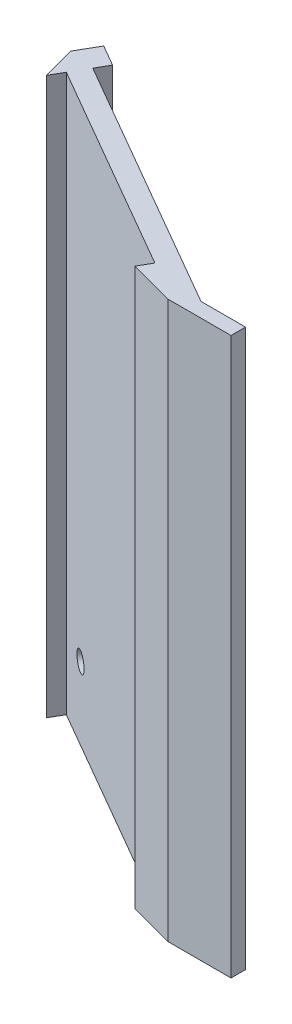
from build123d import *

# Parameters (mm, degrees)
BOSS_EXTRU_1_DEPTH      = 115
ESQUISSE3_R             = 2.0000000000000027
ESQUISSE3_R_2           = 2.0000000000000036
ENL_V_MAT_EXTRU_1_DEPTH = 115
ESQUISSE4_W             = 16
ESQUISSE4_H             = 22
BOSS_EXTRU_2_DEPTH      = 3
CONG_1_R                = 3.5


with BuildPart() as part:
    # Esquisse1 → Boss.-Extru.1 (new body)
    with BuildSketch(Plane(origin=(0, 0, 0), x_dir=(1, 0, 0), z_dir=(0, 1, 0))):
        Polygon((-9.665063509740824, 2.102761677791812), (-11.16506350974071, -0.4953145335614556), (-1.834936490818464, -2.99531453356143), (11.165063509180728, -2.9953145335603057), (11.165063509180731, 0.00468546643886736), (1.9689110864743, 0.00468546643886637), (-7.660052187463922, 5.563970004664114), (-50.96633369896256, 30.56686329292954), (-49.46633369896244, 33.164939504283076), (-53.79646071788463, 35.664939504283076), (-55.29646071788474, 33.06686329292953), (-56.29646071788462, 31.334812485360874), (-54.466333698962515, 24.504685466438406), (-52.96633369896275, 27.10276167779183), align=None)
    extrude(amount=BOSS_EXTRU_1_DEPTH)

    # Esquisse3 → Enlèv. mat.-Extru.1 (cut)
    with BuildSketch(Plane(origin=(-1.5057433618991607, 0, 2.6080240059689155), x_dir=(0.8660254037844384, 0, 0.5000000000000006), z_dir=(-0.5000000000000006, 0, 0.8660254037844385))):
        with Locations((-51.421571367521196, 15)):
            Circle(ESQUISSE3_R)
        with Locations((-17.42157136752137, 15)):
            Circle(ESQUISSE3_R_2)
    extrude(amount=-ENL_V_MAT_EXTRU_1_DEPTH, mode=Mode.SUBTRACT)

    # Esquisse4 → Boss.-Extru.2 (add)
    # profile 1 of 2: a face of its own
    with BuildSketch(Plane(origin=(0.4942566381008935, 0, -0.8560776091689317), x_dir=(-0.8660254037844388, 0, -0.49999999999999983), z_dir=(0.4999999999999998, 0, -0.8660254037844387))):
        with Locations((17.42157136752138, 11)):
            Rectangle(ESQUISSE4_W, ESQUISSE4_H)
        Polygon((19.73097244427988, 11.000000000000002), (22.040373521038383, 14.999999999999996), (19.730972444279878, 18.999999999999996), (15.112170290762874, 18.999999999999996), (12.802769214004368, 14.999999999999996), (15.112170290762867, 11.000000000000002), align=None, mode=Mode.SUBTRACT)
    # profile 2 of 2: a face of its own
    with BuildSketch(Plane(origin=(0.4942566381008935, 0, -0.8560776091689317), x_dir=(-0.8660254037844388, 0, -0.49999999999999983), z_dir=(0.4999999999999998, 0, -0.8660254037844387))):
        Polygon((43.42157136752119, 0), (59.42157136752126, 0), (59.42157136752126, 22.000000000000007), (43.42157136752119, 22), align=None)
        Polygon((49.11217029076269, 10.999999999999996), (53.73097244427969, 10.999999999999996), (56.0403735210382, 14.999999999999993), (53.7309724442797, 18.999999999999982), (49.11217029076269, 18.999999999999982), (46.80276921400419, 14.999999999999998), align=None, mode=Mode.SUBTRACT)
    extrude(amount=BOSS_EXTRU_2_DEPTH)

    # Congé1
    # the kernel refuses this fillet: 3.5 mm, written as the material it adds along each edge
    with BuildSketch(Plane(origin=(-21.521469970291736, 0, -13.566863292929616), x_dir=(-0.8660254037844398, 0, -0.499999999999998), z_dir=(0, 1, 0))) as cong_1_piece_1:
        with BuildLine():
            CenterArc((3.464101615137791, -3.4999999999999996), CONG_1_R, 89.99999999999986, 81.78678929826208)
            Line((3.411e-14, -3.000000000000007), (-0.06928203230272056, -2.990000000000007))
            ThreePointArc((-0.06928203230272056, -2.990000000000007), (-0.0700000000000017, -1.5000000000000009), (-0.06999999999999917, 8.1e-16))
            Line((-0.06999999999999917, 8.1e-16), (-8e-17, 0.07000000000000071))
            Line((-8e-17, 0.07000000000000071), (3.464101615137799, 0.0700000000000007))
            Line((3.464101615137799, 0.0700000000000007), (3.4641016151377992, -8e-17))
        make_face()
    extrude(amount=22)
    with BuildSketch(Plane(origin=(-7.665063509740717, 22, -5.56686329292962), x_dir=(0.8660254037844386, 0, 0.5000000000000001), z_dir=(0, -1, 0))) as cong_1_piece_2:
        with BuildLine():
            CenterArc((3.4641016151377975, -3.5), CONG_1_R, 89.99999999999999, 81.78678929826192)
            Line((4.212e-14, -3.000000000000006), (-0.06928203230271353, -2.9900000000000064))
            ThreePointArc((-0.06928203230271353, -2.9900000000000064), (-0.07000000000000044, -1.5000000000000042), (-0.06999999999999994, -1.9e-16))
            Line((-0.06999999999999994, -1.9e-16), (-1.9e-16, 0.06999999999999994))
            Line((-1.9e-16, 0.06999999999999994), (3.464101615137799, 0.07000000000000006))
            Line((3.464101615137799, 0.07000000000000006), (3.464101615137799, -1e-16))
        make_face()
    extrude(amount=22)
    with BuildSketch(Plane(origin=(-21.521469970291736, 22, -13.566863292929616), x_dir=(-7e-16, 1, 1.21e-15), z_dir=(0.8660254037844388, 0, 0.49999999999999983))) as cong_1_piece_3:
        with BuildLine():
            CenterArc((3.4641016151377912, -3.5), CONG_1_R, 89.99999999999993, 81.78678929826201)
            Line((3.488e-14, -3.0000000000000067), (-0.06928203230272052, -2.990000000000006))
            ThreePointArc((-0.06928203230272052, -2.990000000000006), (-0.0700000000000024, -1.500000000000003), (-0.07000000000000028, 3.4e-16))
            Line((-0.07000000000000028, 3.4e-16), (1e-16, 0.07000000000000095))
            Line((1e-16, 0.07000000000000095), (3.464101615137796, 0.07000000000000071))
            Line((3.464101615137796, 0.07000000000000071), (3.464101615137796, 0))
        make_face()
    extrude(amount=16)
    with BuildSketch(Plane(origin=(-37.10992723841147, 22, -22.56686329292952), x_dir=(0.5000000000000127, 0, -0.8660254037844313), z_dir=(0, -1, 0))) as cong_1_piece_4:
        with BuildLine():
            CenterArc((3.5000000000000466, 3.464101615137746), CONG_1_R, 179.99999999999915, 81.78678929826202)
            Line((4.591e-14, 3.464101615137798), (-0.06999999999995148, 3.4641016151378015))
            Line((-0.06999999999995148, 3.4641016151378015), (-0.06999999999999738, 3.46e-15))
            Line((-0.06999999999999738, 3.46e-15), (-3.8e-16, -0.06999999999999916))
            ThreePointArc((-3.8e-16, -0.06999999999999916), (1.5000000000000058, -0.07000000000002472), (2.9900000000000095, -0.06928203230275311))
            Line((2.9900000000000095, -0.06928203230275311), (3.000000000000009, -2e-17))
        make_face()
    extrude(amount=22)
    with BuildSketch(Plane(origin=(-50.96633369896256, 22.000000000000007, -30.56686329292955), x_dir=(0.4999999999999998, 1.3026616822268463e-14, -0.8660254037844388), z_dir=(0.8660254037844388, 0, 0.49999999999999983))) as cong_1_piece_5:
        with BuildLine():
            CenterArc((3.5000000000000306, 3.4641016151377513), CONG_1_R, 179.99999999999926, 81.78678929826219)
            Line((2.927e-14, 3.464101615137797), (-0.06999999999996813, 3.464101615137798))
            Line((-0.06999999999996813, 3.464101615137798), (-0.06999999999999787, 9.1e-16))
            Line((-0.06999999999999787, 9.1e-16), (2.16e-15, -0.0700000000000003))
            ThreePointArc((2.16e-15, -0.0700000000000003), (1.5000000000000022, -0.07000000000001984), (2.990000000000009, -0.0692820323027553))
            Line((2.990000000000009, -0.0692820323027553), (3.0000000000000093, 0))
        make_face()
    extrude(amount=16.000000000000075)
    with BuildSketch(Plane(origin=(-50.96633369896256, 22.000000000000007, -30.56686329292955), x_dir=(0.8660254037844387, 0, 0.49999999999999983), z_dir=(0.49999999999999983, 0, -0.8660254037844388))) as cong_1_piece_6:
        with BuildLine():
            CenterArc((CONG_1_R, -CONG_1_R), CONG_1_R, 90, 90)
            Line((-1.78e-15, -CONG_1_R), (-CONG_1_R * 0.02, -CONG_1_R))
            Line((-CONG_1_R * 0.02, -CONG_1_R), (-CONG_1_R * 0.02, CONG_1_R * 0.02))
            Line((-CONG_1_R * 0.02, CONG_1_R * 0.02), (CONG_1_R, CONG_1_R * 0.02))
            Line((CONG_1_R, CONG_1_R * 0.02), (CONG_1_R, 0))
        make_face()
    extrude(amount=3.0000000000000036)
    with BuildSketch(Plane(origin=(-29.02146997029182, 22, -17.89699031185185), x_dir=(0, 1, 0), z_dir=(0.8660254037844388, 0, 0.49999999999999983))) as cong_1_piece_7a_section:
        with BuildLine():
            CenterArc((3.4641016151377926, -3.5000000000000013), CONG_1_R, 90, 81.78678929826191)
            Line((3.553e-14, -3.000000000000007), (-0.0692820323027199, -2.9900000000000064))
            ThreePointArc((-0.0692820323027199, -2.9900000000000064), (-0.07000000000000028, -1.500000000000002), (-0.07000000000000028, 0))
            Line((-0.07000000000000028, 0), (0, 0.0699999999999974))
            Line((0, 0.0699999999999974), (3.4641016151377926, 0.06999999999999917))
            Line((3.4641016151377926, 0.06999999999999917), (3.4641016151377926, 0))
        make_face()
    cong_1_piece_7a = extrude(amount=24.660254037844485, mode=Mode.PRIVATE)
    cong_1_piece_7a = split(cong_1_piece_7a, bisect_by=Plane(origin=(-21.154506205499796, 22.800005921132424, -14.202463178086015), z_dir=(-0.8660254037844388, 0, -0.49999999999999983)), keep=Keep.TOP, mode=Mode.PRIVATE)
    with BuildSketch(Plane(origin=(-21.521469970291736, 0, -13.566863292929616), x_dir=(-0.8660254037844398, 0, -0.499999999999998), z_dir=(0, 1, 0))) as cong_1_piece_7b_section:
        with BuildLine():
            CenterArc((3.464101615137791, -3.4999999999999996), CONG_1_R, 89.99999999999986, 81.78678929826208)
            Line((3.411e-14, -3.000000000000007), (-0.06928203230272056, -2.990000000000007))
            ThreePointArc((-0.06928203230272056, -2.990000000000007), (-0.0700000000000017, -1.5000000000000009), (-0.06999999999999917, 8.1e-16))
            Line((-0.06999999999999917, 8.1e-16), (-8e-17, 0.07000000000000071))
            Line((-8e-17, 0.07000000000000071), (3.464101615137799, 0.0700000000000007))
            Line((3.464101615137799, 0.0700000000000007), (3.4641016151377992, -8e-17))
        make_face()
    cong_1_piece_7b = extrude(amount=30.660254037844496, mode=Mode.PRIVATE)
    cong_1_piece_7b = split(cong_1_piece_7b, bisect_by=Plane(origin=(-21.84733165637773, 22, -14.602466138652442), z_dir=(0, 1, 0)), keep=Keep.TOP, mode=Mode.PRIVATE)
    cong_1_piece_7 = cong_1_piece_7a & cong_1_piece_7b
    add(cong_1_piece_7)
    with BuildSketch(Plane(origin=(-7.665063509740719, 30.660254037844496, -5.566863292929618), x_dir=(0.8660254037844389, 0, 0.4999999999999995), z_dir=(0, -1, 0))) as cong_1_piece_8a_section:
        with BuildLine():
            CenterArc((3.4641016151378006, -3.5), CONG_1_R, 90.00000000000001, 81.78678929826195)
            Line((4.504e-14, -3.0000000000000084), (-0.06928203230271082, -2.990000000000009))
            ThreePointArc((-0.06928203230271082, -2.990000000000009), (-0.06999999999999906, -1.5000000000000056), (-0.06999999999999994, -2.4e-16))
            Line((-0.06999999999999994, -2.4e-16), (-2.4e-16, 0.06999999999999994))
            Line((-2.4e-16, 0.06999999999999994), (3.4641016151377992, 0.07))
            Line((3.4641016151377992, 0.07), (3.4641016151377997, 5e-17))
        make_face()
    cong_1_piece_8a = extrude(amount=30.660254037844496, mode=Mode.PRIVATE)
    cong_1_piece_8a = split(cong_1_piece_8a, bisect_by=Plane(origin=(-6.605274294070357, 22, -5.802460217520097), z_dir=(0, 1, 0)), keep=Keep.TOP, mode=Mode.PRIVATE)
    with BuildSketch(Plane(origin=(-21.521469970291736, 22, -13.566863292929616), x_dir=(-7e-16, 1, 1.21e-15), z_dir=(0.8660254037844388, 0, 0.49999999999999983))) as cong_1_piece_8b_section:
        with BuildLine():
            CenterArc((3.4641016151377912, -3.5), CONG_1_R, 89.99999999999993, 81.78678929826201)
            Line((3.488e-14, -3.0000000000000067), (-0.06928203230272052, -2.990000000000006))
            ThreePointArc((-0.06928203230272052, -2.990000000000006), (-0.0700000000000024, -1.500000000000003), (-0.07000000000000028, 3.4e-16))
            Line((-0.07000000000000028, 3.4e-16), (1e-16, 0.07000000000000095))
            Line((1e-16, 0.07000000000000095), (3.464101615137796, 0.07000000000000071))
            Line((3.464101615137796, 0.07000000000000071), (3.464101615137796, 0))
        make_face()
    cong_1_piece_8b = extrude(amount=24.66025403784449, mode=Mode.PRIVATE)
    cong_1_piece_8b = split(cong_1_piece_8b, bisect_by=Plane(origin=(-7.298099744948748, 22.800005921132424, -6.202463178086066), z_dir=(0.8660254037844388, 0, 0.49999999999999983)), keep=Keep.TOP, mode=Mode.PRIVATE)
    cong_1_piece_8 = cong_1_piece_8a & cong_1_piece_8b
    add(cong_1_piece_8)
    with BuildSketch(Plane(origin=(-50.96633369896256, 22.000000000000007, -30.56686329292955), x_dir=(0.4999999999999998, 1.3026616822268463e-14, -0.8660254037844388), z_dir=(0.8660254037844388, 0, 0.49999999999999983))) as cong_1_piece_9a_section:
        with BuildLine():
            CenterArc((3.5000000000000306, 3.4641016151377513), CONG_1_R, 179.99999999999926, 81.78678929826219)
            Line((2.927e-14, 3.464101615137797), (-0.06999999999996813, 3.464101615137798))
            Line((-0.06999999999996813, 3.464101615137798), (-0.06999999999999787, 9.1e-16))
            Line((-0.06999999999999787, 9.1e-16), (2.16e-15, -0.0700000000000003))
            ThreePointArc((2.16e-15, -0.0700000000000003), (1.5000000000000022, -0.07000000000001984), (2.990000000000009, -0.0692820323027553))
            Line((2.990000000000009, -0.0692820323027553), (3.0000000000000093, 0))
        make_face()
    cong_1_piece_9a = extrude(amount=24.660254037844567, mode=Mode.PRIVATE)
    cong_1_piece_9a = split(cong_1_piece_9a, bisect_by=Plane(origin=(-36.742963473619156, 22.800005921131838, -23.202463178086564), z_dir=(0.8660254037844388, 0, 0.49999999999999983)), keep=Keep.TOP, mode=Mode.PRIVATE)
    with BuildSketch(Plane(origin=(-37.10992723841147, 30.660254037844496, -22.56686329292951), x_dir=(0.5000000000000099, 0, -0.8660254037844329), z_dir=(0, -1, 0))) as cong_1_piece_9b_section:
        with BuildLine():
            CenterArc((3.5000000000000386, 3.4641016151377477), CONG_1_R, 179.99999999999935, 81.78678929826202)
            Line((3.741e-14, 3.464101615137789), (-0.06999999999996008, 3.464101615137792))
            Line((-0.06999999999996008, 3.464101615137792), (-0.0699999999999974, 3.23e-15))
            Line((-0.0699999999999974, 3.23e-15), (-1.6e-16, -0.06999999999999917))
            ThreePointArc((-1.6e-16, -0.06999999999999917), (1.500000000000006, -0.07000000000001991), (2.9900000000000126, -0.06928203230275315))
            Line((2.9900000000000126, -0.06928203230275315), (3.0000000000000115, 9e-17))
        make_face()
    cong_1_piece_9b = extrude(amount=30.660254037844496, mode=Mode.PRIVATE)
    cong_1_piece_9b = split(cong_1_piece_9b, bisect_by=Plane(origin=(-36.05013802274124, 22, -22.80246021752022), z_dir=(3.8e-16, 1, 2.2e-16)), keep=Keep.TOP, mode=Mode.PRIVATE)
    cong_1_piece_9 = cong_1_piece_9a & cong_1_piece_9b
    add(cong_1_piece_9)
    with BuildSketch(Plane(origin=(-55.34133369896255, 22.000000000000007, -22.989141009815718), x_dir=(0.8660254037844387, 0, 0.49999999999999983), z_dir=(0.49999999999999983, 0, -0.8660254037844388))) as cong_1_piece_10a_section:
        with BuildLine():
            CenterArc((CONG_1_R, -CONG_1_R), CONG_1_R, 90, 90)
            Line((-7.93e-15, -CONG_1_R), (-CONG_1_R * 0.02, -CONG_1_R))
            Line((-CONG_1_R * 0.02, -CONG_1_R), (-CONG_1_R * 0.02, CONG_1_R * 0.02))
            Line((-CONG_1_R * 0.02, CONG_1_R * 0.02), (CONG_1_R, CONG_1_R * 0.02))
            Line((CONG_1_R, CONG_1_R * 0.02), (CONG_1_R, 0))
        make_face()
    cong_1_piece_10a = extrude(amount=11.749999999999995, mode=Mode.PRIVATE)
    cong_1_piece_10a = split(cong_1_piece_10a, bisect_by=Plane(origin=(-50.280109978095446, 22.79238289993389, -30.170671842962605), z_dir=(-0.49999999999999967, 0, 0.8660254037844389)), keep=Keep.TOP, mode=Mode.PRIVATE)
    with BuildSketch(Plane(origin=(-58.46633369896265, 22.00000000000001, -34.89699031185178), x_dir=(0.4999999999999998, 1.3026616822268407e-14, -0.8660254037844388), z_dir=(0.8660254037844388, 0, 0.49999999999999983))) as cong_1_piece_10b_section:
        with BuildLine():
            CenterArc((3.500000000000043, 3.4641016151377513), CONG_1_R, 179.99999999999926, 81.78678929826219)
            Line((4.513e-14, 3.464101615137797), (-0.06999999999995227, 3.464101615137798))
            Line((-0.06999999999995227, 3.464101615137798), (-0.0699999999999974, 9.1e-16))
            Line((-0.0699999999999974, 9.1e-16), (-9.1e-16, -0.0700000000000003))
            ThreePointArc((-9.1e-16, -0.0700000000000003), (1.5000000000000213, -0.07000000000001984), (2.990000000000022, -0.0692820323027553))
            Line((2.990000000000022, -0.0692820323027553), (3.000000000000022, 0))
        make_face()
    cong_1_piece_10b = extrude(amount=24.66025403784456, mode=Mode.PRIVATE)
    cong_1_piece_10b = split(cong_1_piece_10b, bisect_by=Plane(origin=(-50.59936993417017, 22.80000592113141, -31.202463178086727), z_dir=(-0.8660254037844386, 0, -0.5000000000000002)), keep=Keep.TOP, mode=Mode.PRIVATE)
    cong_1_piece_10 = cong_1_piece_10a & cong_1_piece_10b
    add(cong_1_piece_10)


solid = part.part
